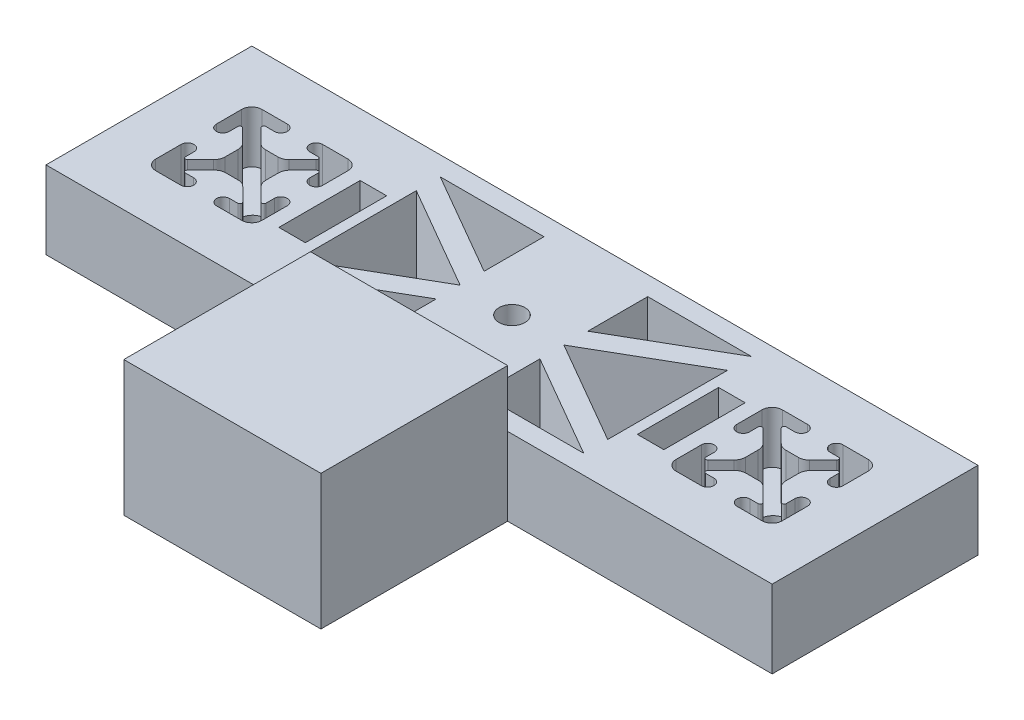
from build123d import *

# Parameters (mm, degrees)
SKETCH1_W               = 177.8
SKETCH1_H               = 50.4000008
BOSS_EXTRUDE1_DEPTH     = 6.35
SKETCH2_W               = 177.8
SKETCH2_H               = 50.4000008
BOSS_EXTRUDE2_DEPTH     = 12.7
SKETCH3_R               = 3.175
CUT_EXTRUDE1_DEPTH      = 10.16
CUT_EXTRUDE2_DEPTH      = 186.784559586
SKETCH5_W               = 6.5
SKETCH5_H               = 19.9
CUT_EXTRUDE3_DEPTH      = 10.2
SKETCH6_W               = 6.5
SKETCH6_H               = 4.572
CUT_EXTRUDE4_DEPTH      = 186.086574555
CUT_EXTRUDE5_DEPTH      = 186.241167349
CUT_EXTRUDE5_DEPTH_BACK = 186.241167349
SKETCH7_R               = 2.921
CUT_EXTRUDE6_DEPTH      = 186.241167349
CUT_EXTRUDE6_DEPTH_BACK = 186.241167349
SKETCH8_R               = 2.921
CHAMFER2_SIZE           = 3.302
CHAMFER3_SIZE           = 3.302
CUT_EXTRUDE8_DEPTH      = 5.08
SKETCH9_W               = 48.26
SKETCH9_H               = 45.72
BOSS_EXTRUDE4_DEPTH     = 33.02


with BuildPart() as part:
    # Sketch1 → Boss-Extrude1 (new body)
    with BuildSketch(Plane(origin=(0, 0, 0), x_dir=(1, 0, 0), z_dir=(0, 1, 0))):
        with Locations((88.9, 25.2000004)):
            Rectangle(SKETCH1_W, SKETCH1_H)
    extrude(amount=BOSS_EXTRUDE1_DEPTH)

    # Sketch2 → Boss-Extrude2 (add)
    with BuildSketch(Plane(origin=(0, 6.35, 0), x_dir=(1, 0, 0), z_dir=(0, 1, 0))):
        with Locations((88.9, 25.2000004)):
            Rectangle(SKETCH2_W, SKETCH2_H)
        with BuildLine():
            Line((38.207602115, 29.52001185), (38.207602115, 35.7371571))
            ThreePointArc((38.207602115, 35.7371571), (37.48390875, 37.484307436), (35.736758415, 38.2080008))
            Line((35.736758415, 38.2080008), (29.519613165, 38.2080008))
            ThreePointArc((29.519613165, 38.2080008), (27.941613165, 36.6300008), (29.519613165, 35.0520008))
            Line((29.519613165, 35.0520008), (31.618952135, 35.0520008))
            ThreePointArc((31.618952135, 35.0520008), (32.082805957, 34.741944038), (31.973665066, 34.194784253))
            Line((31.973665066, 34.194784253), (28.637609194, 30.863479703))
            ThreePointArc((28.637609194, 30.863479703), (27.774459736, 30.287408726), (26.756632806, 30.085138862))
            Line((26.756632806, 30.085138862), (23.642969309, 30.085138862))
            ThreePointArc((23.642969309, 30.085138862), (22.625142379, 30.287408726), (21.761992921, 30.863479703))
            Line((21.761992921, 30.863479703), (18.425937049, 34.194784253))
            ThreePointArc((18.425937049, 34.194784253), (18.316796158, 34.741944038), (18.78064998, 35.0520008))
            Line((18.78064998, 35.0520008), (20.87998895, 35.0520008))
            ThreePointArc((20.87998895, 35.0520008), (22.45798895, 36.6300008), (20.87998895, 38.2080008))
            Line((20.87998895, 38.2080008), (14.6628437, 38.2080008))
            ThreePointArc((14.6628437, 38.2080008), (12.915693364, 37.484307436), (12.192, 35.7371571))
            Line((12.192, 35.7371571), (12.192, 29.52001185))
            ThreePointArc((12.192, 29.52001185), (13.77, 27.94201185), (15.348, 29.52001185))
            Line((15.348, 29.52001185), (15.348, 31.596493464))
            ThreePointArc((15.348, 31.596493464), (15.657726258, 32.060210386), (16.204710632, 31.95171231))
            Line((16.204710632, 31.95171231), (19.406929995, 28.754053655))
            ThreePointArc((19.406929995, 28.754053655), (20.019806023, 27.837880259), (20.235040084, 26.756832148))
            Line((20.235040084, 26.756832148), (20.235040084, 23.643168652))
            ThreePointArc((20.235040084, 23.643168652), (20.019806023, 22.562120541), (19.406929995, 21.645947145))
            Line((19.406929995, 21.645947145), (16.204710632, 18.44828849))
            ThreePointArc((16.204710632, 18.44828849), (15.657726258, 18.339790414), (15.348, 18.803507336))
            Line((15.348, 18.803507336), (15.348, 20.87998895))
            ThreePointArc((15.348, 20.87998895), (13.77, 22.45798895), (12.192, 20.87998895))
            Line((12.192, 20.87998895), (12.192, 14.6628437))
            ThreePointArc((12.192, 14.6628437), (12.915693364, 12.915693364), (14.6628437, 12.192))
            Line((14.6628437, 12.192), (20.812064149, 12.192))
            ThreePointArc((20.812064149, 12.192), (22.390064149, 13.77), (20.812064149, 15.348))
            Line((20.812064149, 15.348), (18.78064998, 15.348))
            ThreePointArc((18.78064998, 15.348), (18.316796158, 15.658056762), (18.425937049, 16.205216547))
            Line((18.425937049, 16.205216547), (21.761992921, 19.536521097))
            ThreePointArc((21.761992921, 19.536521097), (22.625142379, 20.112592074), (23.642969309, 20.314861938))
            Line((23.642969309, 20.314861938), (26.756632806, 20.314861938))
            ThreePointArc((26.756632806, 20.314861938), (27.774459736, 20.112592074), (28.637609194, 19.536521097))
            Line((28.637609194, 19.536521097), (31.973665066, 16.205216547))
            ThreePointArc((31.973665066, 16.205216547), (32.082805957, 15.658056762), (31.618952135, 15.348))
            Line((31.618952135, 15.348), (29.587537966, 15.348))
            ThreePointArc((29.587537966, 15.348), (28.009537966, 13.77), (29.587537966, 12.192))
            Line((29.587537966, 12.192), (35.736758415, 12.192))
            ThreePointArc((35.736758415, 12.192), (37.48390875, 12.915693364), (38.207602115, 14.6628437))
            Line((38.207602115, 14.6628437), (38.207602115, 20.87998895))
            ThreePointArc((38.207602115, 20.87998895), (36.629602115, 22.45798895), (35.051602115, 20.87998895))
            Line((35.051602115, 20.87998895), (35.051602115, 18.803507336))
            ThreePointArc((35.051602115, 18.803507336), (34.741875857, 18.339790414), (34.194891482, 18.44828849))
            Line((34.194891482, 18.44828849), (30.99267212, 21.645947145))
            ThreePointArc((30.99267212, 21.645947145), (30.379796092, 22.562120541), (30.16456203, 23.643168652))
            Line((30.16456203, 23.643168652), (30.16456203, 26.756832148))
            ThreePointArc((30.16456203, 26.756832148), (30.379796092, 27.837880259), (30.99267212, 28.754053655))
            Line((30.99267212, 28.754053655), (34.194891482, 31.95171231))
            ThreePointArc((34.194891482, 31.95171231), (34.741875857, 32.060210386), (35.051602115, 31.596493464))
            Line((35.051602115, 31.596493464), (35.051602115, 29.52001185))
            ThreePointArc((35.051602115, 29.52001185), (36.629602115, 27.94201185), (38.207602115, 29.52001185))
        make_face(mode=Mode.SUBTRACT)
        with BuildLine():
            Line((142.748397885, 31.596493464), (142.748397885, 29.52001185))
            ThreePointArc((142.748397885, 29.52001185), (141.170397885, 27.94201185), (139.592397885, 29.52001185))
            Line((139.592397885, 29.52001185), (139.592397885, 35.7371571))
            ThreePointArc((139.592397885, 35.7371571), (140.31609125, 37.484307436), (142.063241585, 38.2080008))
            Line((142.063241585, 38.2080008), (148.280386835, 38.2080008))
            ThreePointArc((148.280386835, 38.2080008), (149.858386835, 36.6300008), (148.280386835, 35.0520008))
            Line((148.280386835, 35.0520008), (146.181047865, 35.0520008))
            ThreePointArc((146.181047865, 35.0520008), (145.717194043, 34.741944038), (145.826334934, 34.194784253))
            Line((145.826334934, 34.194784253), (149.162390806, 30.863479703))
            ThreePointArc((149.162390806, 30.863479703), (150.025540264, 30.287408726), (151.043367194, 30.085138862))
            Line((151.043367194, 30.085138862), (154.157030691, 30.085138862))
            ThreePointArc((154.157030691, 30.085138862), (155.174857621, 30.287408726), (156.038007079, 30.863479703))
            Line((156.038007079, 30.863479703), (159.374062951, 34.194784253))
            ThreePointArc((159.374062951, 34.194784253), (159.483203842, 34.741944038), (159.01935002, 35.0520008))
            Line((159.01935002, 35.0520008), (156.92001105, 35.0520008))
            ThreePointArc((156.92001105, 35.0520008), (155.34201105, 36.6300008), (156.92001105, 38.2080008))
            Line((156.92001105, 38.2080008), (163.1371563, 38.2080008))
            ThreePointArc((163.1371563, 38.2080008), (164.884306636, 37.484307436), (165.608, 35.7371571))
            Line((165.608, 35.7371571), (165.608, 29.52001185))
            ThreePointArc((165.608, 29.52001185), (164.03, 27.94201185), (162.452, 29.52001185))
            Line((162.452, 29.52001185), (162.452, 31.596493464))
            ThreePointArc((162.452, 31.596493464), (162.142273742, 32.060210386), (161.595289368, 31.95171231))
            Line((161.595289368, 31.95171231), (158.393070005, 28.754053655))
            ThreePointArc((158.393070005, 28.754053655), (157.780193977, 27.837880259), (157.564959916, 26.756832148))
            Line((157.564959916, 26.756832148), (157.564959916, 23.643168652))
            ThreePointArc((157.564959916, 23.643168652), (157.780193977, 22.562120541), (158.393070005, 21.645947145))
            Line((158.393070005, 21.645947145), (161.595289368, 18.44828849))
            ThreePointArc((161.595289368, 18.44828849), (162.142273742, 18.339790414), (162.452, 18.803507336))
            Line((162.452, 18.803507336), (162.452, 20.87998895))
            ThreePointArc((162.452, 20.87998895), (164.03, 22.45798895), (165.608, 20.87998895))
            Line((165.608, 20.87998895), (165.608, 14.6628437))
            ThreePointArc((165.608, 14.6628437), (164.884306636, 12.915693364), (163.1371563, 12.192))
            Line((163.1371563, 12.192), (156.987935851, 12.192))
            ThreePointArc((156.987935851, 12.192), (155.409935851, 13.77), (156.987935851, 15.348))
            Line((156.987935851, 15.348), (159.01935002, 15.348))
            ThreePointArc((159.01935002, 15.348), (159.483203842, 15.658056762), (159.374062951, 16.205216547))
            Line((159.374062951, 16.205216547), (156.038007079, 19.536521097))
            ThreePointArc((156.038007079, 19.536521097), (155.174857621, 20.112592074), (154.157030691, 20.314861938))
            Line((154.157030691, 20.314861938), (151.043367194, 20.314861938))
            ThreePointArc((151.043367194, 20.314861938), (150.025540264, 20.112592074), (149.162390806, 19.536521097))
            Line((149.162390806, 19.536521097), (145.826334934, 16.205216547))
            ThreePointArc((145.826334934, 16.205216547), (145.717194043, 15.658056762), (146.181047865, 15.348))
            Line((146.181047865, 15.348), (148.212462034, 15.348))
            ThreePointArc((148.212462034, 15.348), (149.790462034, 13.77), (148.212462034, 12.192))
            Line((148.212462034, 12.192), (142.063241585, 12.192))
            ThreePointArc((142.063241585, 12.192), (140.31609125, 12.915693364), (139.592397885, 14.6628437))
            Line((139.592397885, 14.6628437), (139.592397885, 20.87998895))
            ThreePointArc((139.592397885, 20.87998895), (141.170397885, 22.45798895), (142.748397885, 20.87998895))
            Line((142.748397885, 20.87998895), (142.748397885, 18.803507336))
            ThreePointArc((142.748397885, 18.803507336), (143.058124143, 18.339790414), (143.605108518, 18.44828849))
            Line((143.605108518, 18.44828849), (146.80732788, 21.645947145))
            ThreePointArc((146.80732788, 21.645947145), (147.420203908, 22.562120541), (147.63543797, 23.643168652))
            Line((147.63543797, 23.643168652), (147.63543797, 26.756832148))
            ThreePointArc((147.63543797, 26.756832148), (147.420203908, 27.837880259), (146.80732788, 28.754053655))
            Line((146.80732788, 28.754053655), (143.605108518, 31.95171231))
            ThreePointArc((143.605108518, 31.95171231), (143.058124143, 32.060210386), (142.748397885, 31.596493464))
        make_face(mode=Mode.SUBTRACT)
    extrude(amount=BOSS_EXTRUDE2_DEPTH)

    # Sketch3 → Cut-Extrude1 (cut)
    with BuildSketch(Plane(origin=(0, 19.05, 0), x_dir=(1, 0, 0), z_dir=(0, 1, 0))):
        with Locations((88.9, 25.2000004)):
            Circle(SKETCH3_R)
    extrude(amount=-CUT_EXTRUDE1_DEPTH, mode=Mode.SUBTRACT)

    # Sketch4 → Cut-Extrude2 (cut, through all)
    with BuildSketch(Plane(origin=(0, 19.05, 0), x_dir=(1, 0, 0), z_dir=(0, 1, 0))):
        Polygon((50.8, 45.730575972), (76.2, 45.730575972), (76.2, 31.065879135), align=None)
        Polygon((76.2, 19.334121665), (76.2, 4.669424828), (50.8, 4.669424828), align=None)
        Polygon((50.8, 39.864697237), (50.8, 10.535303563), (76.2, 25.2000004), align=None)
        Polygon((101.6, 25.2000004), (127, 39.864697237), (127, 10.535303563), align=None)
        Polygon((127, 4.669424828), (101.6, 19.334121665), (101.6, 4.669424828), align=None)
        Polygon((101.6, 31.065879135), (127, 45.730575972), (101.6, 45.730575972), align=None)
    extrude(amount=-CUT_EXTRUDE2_DEPTH, mode=Mode.SUBTRACT)

    # Sketch5 → Cut-Extrude3 (cut)
    with BuildSketch(Plane(origin=(0, 19.05, 0), x_dir=(1, 0, 0), z_dir=(0, 1, 0))):
        with Locations((45.013602115, 25.2000004)):
            Rectangle(SKETCH5_W, SKETCH5_H)
    cut_extrude3 = extrude(amount=-CUT_EXTRUDE3_DEPTH, mode=Mode.SUBTRACT)

    # Sketch6 → Cut-Extrude4 (cut, through all)
    with BuildSketch(Plane(origin=(0, 8.85, 0), x_dir=(1, 0, 0), z_dir=(0, 1, 0))):
        with Locations((45.013602115, 32.8640004)):
            Rectangle(SKETCH6_W, SKETCH6_H)
        with Locations((45.013602115, 25.2000004)):
            Rectangle(SKETCH6_W, SKETCH6_H)
        with Locations((45.013602115, 17.5360004)):
            Rectangle(SKETCH6_W, SKETCH6_H)
    cut_extrude4 = extrude(amount=-CUT_EXTRUDE4_DEPTH, mode=Mode.SUBTRACT)

    # Mirror1: Cut-Extrude3, Cut-Extrude4 across plane
    add(cut_extrude3.mirror(Plane.ZY.offset(-88.9)), mode=Mode.SUBTRACT)
    add(cut_extrude4.mirror(Plane.ZY.offset(-88.9)), mode=Mode.SUBTRACT)

    # Sketch7 → Cut-Extrude5 (cut, two sides: drawn at the far end of the back side and taken through both)
    with BuildSketch(Plane(origin=(0, 6.35, 0), x_dir=(1, 0, 0), z_dir=(0, 1, 0)).offset(-CUT_EXTRUDE5_DEPTH_BACK)):
        with Locations((25.33856203, 25.259138862)):
            Circle(SKETCH7_R)
    extrude(amount=CUT_EXTRUDE5_DEPTH + CUT_EXTRUDE5_DEPTH_BACK, mode=Mode.SUBTRACT)

    # Sketch8 → Cut-Extrude6 (cut, two sides: drawn at the far end of the back side and taken through both)
    with BuildSketch(Plane(origin=(0, 6.35, 0), x_dir=(1, 0, 0), z_dir=(0, 1, 0)).offset(-CUT_EXTRUDE6_DEPTH_BACK)):
        with Locations((152.738959916, 25.259138862)):
            Circle(SKETCH8_R)
    extrude(amount=CUT_EXTRUDE6_DEPTH + CUT_EXTRUDE6_DEPTH_BACK, mode=Mode.SUBTRACT)

    # Chamfer2
    chamfer2_edges = [part.edges().sort_by_distance(p)[0] for p in [
        (149.817959916, 0, -25.259138862),
    ]]
    chamfer(chamfer2_edges, length=CHAMFER2_SIZE)

    # Chamfer3
    chamfer3_edges = [part.edges().sort_by_distance(p)[0] for p in [
        (22.41756203, 0, -25.259138862),
    ]]
    chamfer(chamfer3_edges, length=CHAMFER3_SIZE)

    # Sketch11 → Cut-Extrude8 (cut)
    with BuildSketch(Plane(origin=(0, 0, 0), x_dir=(1, 0, 0), z_dir=(0, 1, 0))):
        Polygon((41.763602115, 15.2500004), (41.763602115, 0), (48.263602115, 0), (48.263602115, 15.2500004), (48.263602115, 35.1500004), (48.263602115, 50.4000008), (41.763602115, 50.4000008), (41.763602115, 35.1500004), align=None)
    extrude(amount=CUT_EXTRUDE8_DEPTH, mode=Mode.SUBTRACT)

    # Sketch9 → Boss-Extrude4 (add)
    with BuildSketch(Plane(origin=(0, 0, 0), x_dir=(1, 0, 0), z_dir=(0, 1, 0))):
        with Locations((88.9, -22.86)):
            Rectangle(SKETCH9_W, SKETCH9_H)
    extrude(amount=BOSS_EXTRUDE4_DEPTH)


solid = part.part
